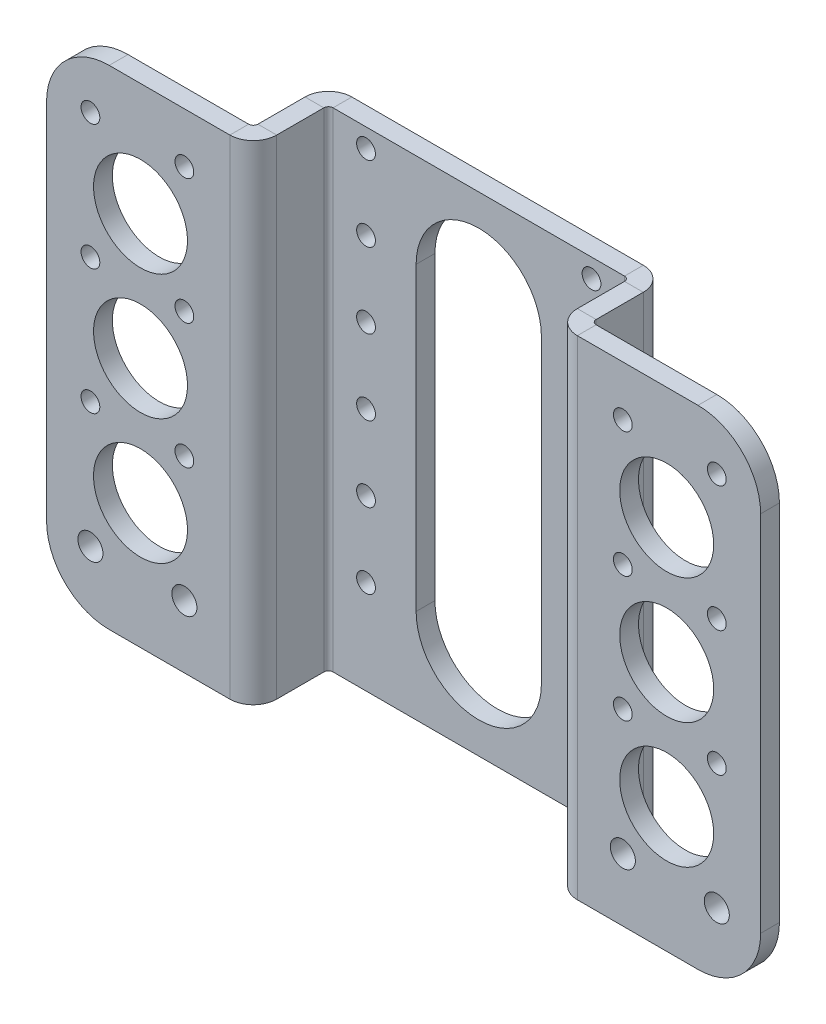
from build123d import *

# Parameters (mm, degrees)
SKETCH_1_W                    = 54
SKETCH_1_H                    = 93
SKETCH_1_R                    = 1.5
SKETCH_1_R_2                  = 1.44222051
EXTRUDE_1_DEPTH               = 15
SKETCH_2_W                    = 30
SKETCH_2_H                    = 93
EXTRUDE_2_DEPTH               = 15
SKETCH_6_W                    = 47.443029091
SKETCH_6_H                    = 20.19917442
SKETCH_6_W_2                  = 54.970930434
SKETCH_6_H_2                  = 26.340800681
SKETCH_6_W_3                  = 48
SKETCH_6_H_3                  = 18.172554383
CUT_EXTRUDE_1_DEPTH           = 111.104495821
SKETCH_7_W                    = 123.210575638
SKETCH_7_H                    = 28.057853858
CUT_EXTRUDE_2_DEPTH           = 106.085679329
SKETCH_9_R                    = 1.5
CUT_EXTRUDE_3_DEPTH           = 87.539008545
EXTRUDE_3_DEPTH               = 8
SKETCH_13_R                   = 2
SKETCH_13_R_2                 = 7.5
CUT_EXTRUDE_6_DEPTH           = 30
FILLET_1_R                    = 10
SHEET_START                   = 3
SHEET_METAL_1_OUTLINE_R       = 7.5
SHEET_METAL_1_OUTLINE_R_2     = 2
SHEET_METAL_1_OUTLINE_R_3     = 1.5
SHEET_METAL_1_DEPTH           = 12
SHEET_METAL_1_2_OUTLINE_R     = 7.5
SHEET_METAL_1_2_OUTLINE_R_2   = 2
SHEET_METAL_1_2_OUTLINE_R_3   = 1.5
SHEET_METAL_1_2_DEPTH         = 3
SHEET_METAL_1_3_OUTLINE_R     = 7.5
SHEET_METAL_1_3_OUTLINE_R_2   = 2
SHEET_METAL_1_3_OUTLINE_R_3   = 1.5
SHEET_METAL_1_3_DEPTH         = 3
SHEET_START_2                 = 12
SHEET_METAL_1_3_2_OUTLINE_R   = 7.5
SHEET_METAL_1_3_2_OUTLINE_R_2 = 2
SHEET_METAL_1_3_2_OUTLINE_R_3 = 1.5
SHEET_METAL_1_3_2_DEPTH       = 3
SHEET_METAL_1_3_3_OUTLINE_W   = 3
SHEET_METAL_1_3_3_OUTLINE_H   = 78
SHEET_METAL_1_3_3_DEPTH       = 9
SHEET_START_3                 = 11.2634
SHEET_METAL_1_3_4_OUTLINE_R   = 2
SHEET_METAL_1_3_4_OUTLINE_R_2 = 1.5
SHEET_METAL_1_3_4_DEPTH       = 0.7366
SHEET_START_4                 = -73
SHEET_METAL_1_3_5_DEPTH       = 80
SHEET_START_5                 = -72
SHEET_METAL_1_3_6_DEPTH       = 78


with BuildPart() as part:
    # Sketch 1 → 보스-돌출1 (new body)
    with BuildSketch(Plane.XY):
        with Locations((0, -40.5)):
            Rectangle(SKETCH_1_W, SKETCH_1_H)
        with Locations((18, -81)):
            Circle(SKETCH_1_R, mode=Mode.SUBTRACT)
        with Locations((-18, -81)):
            Circle(SKETCH_1_R_2, mode=Mode.SUBTRACT)
        with Locations((18, -69)):
            Circle(SKETCH_1_R, mode=Mode.SUBTRACT)
        with Locations((-18, -69)):
            Circle(SKETCH_1_R, mode=Mode.SUBTRACT)
        with Locations((18, -57)):
            Circle(SKETCH_1_R, mode=Mode.SUBTRACT)
        with Locations((-18, -57)):
            Circle(SKETCH_1_R, mode=Mode.SUBTRACT)
        with Locations((18, -45)):
            Circle(SKETCH_1_R, mode=Mode.SUBTRACT)
        with Locations((-18, -45)):
            Circle(SKETCH_1_R, mode=Mode.SUBTRACT)
        with Locations((18, -33)):
            Circle(SKETCH_1_R, mode=Mode.SUBTRACT)
        with Locations((-18, -33)):
            Circle(SKETCH_1_R, mode=Mode.SUBTRACT)
        with Locations((18, -21)):
            Circle(SKETCH_1_R, mode=Mode.SUBTRACT)
        with Locations((-18, -21)):
            Circle(SKETCH_1_R, mode=Mode.SUBTRACT)
        with Locations((18, -9)):
            Circle(SKETCH_1_R, mode=Mode.SUBTRACT)
        with Locations((-18, -9)):
            Circle(SKETCH_1_R, mode=Mode.SUBTRACT)
        with Locations((18, 3)):
            Circle(SKETCH_1_R, mode=Mode.SUBTRACT)
        with Locations((-18, 3)):
            Circle(SKETCH_1_R, mode=Mode.SUBTRACT)
    extrude(amount=EXTRUDE_1_DEPTH)

    # Sketch 2 → 보스-돌출2 (add)
    with BuildSketch(Plane.XY.offset(15)):
        with Locations((42, -40.5)):
            Rectangle(SKETCH_2_W, SKETCH_2_H)
        with Locations((-42, -40.5)):
            Rectangle(SKETCH_2_W, SKETCH_2_H)
    extrude(amount=-EXTRUDE_2_DEPTH)

    # 스케치6 → 컷-돌출1 (cut, through all)
    with BuildSketch(Plane.XZ.offset(87)):
        with Locations((-50.721514545, 1.90041279)):
            Rectangle(SKETCH_6_W, SKETCH_6_H)
        with Locations((54.485465217, -1.170400341)):
            Rectangle(SKETCH_6_W_2, SKETCH_6_H_2)
        with Locations((0, 12.086277192)):
            Rectangle(SKETCH_6_W_3, SKETCH_6_H_3)
    extrude(amount=-CUT_EXTRUDE_1_DEPTH, mode=Mode.SUBTRACT)

    # 스케치7 → 컷-돌출2 (cut, through all)
    with BuildSketch(Plane(origin=(0, 0, 0), x_dir=(-1, 0, 0), z_dir=(0, 0, -1))):
        with Locations((-0.121990669, -78.028926929)):
            Rectangle(SKETCH_7_W, SKETCH_7_H)
    extrude(amount=-CUT_EXTRUDE_2_DEPTH, mode=Mode.SUBTRACT)

    # 스케치9 → 컷-돌출3 (cut, through all)
    with BuildSketch(Plane(origin=(0, 0, 12), x_dir=(-1, 0, 0), z_dir=(0, 0, -1))):
        with Locations((-35, -2)):
            Circle(SKETCH_9_R)
        with Locations((-35, -22)):
            Circle(SKETCH_9_R)
        with Locations((-35, -42)):
            Circle(SKETCH_9_R)
        with Locations((-50, -2)):
            Circle(SKETCH_9_R)
        with Locations((-50, -22)):
            Circle(SKETCH_9_R)
        with Locations((-50, -42)):
            Circle(SKETCH_9_R)
        with Locations((50, -2)):
            Circle(SKETCH_9_R)
        with Locations((35, -2)):
            Circle(SKETCH_9_R)
        with Locations((35, -22)):
            Circle(SKETCH_9_R)
        with Locations((35, -42)):
            Circle(SKETCH_9_R)
        with Locations((50, -42)):
            Circle(SKETCH_9_R)
        with Locations((50, -22)):
            Circle(SKETCH_9_R)
    extrude(amount=-CUT_EXTRUDE_3_DEPTH, mode=Mode.SUBTRACT)

    # 스케치11 → 보스-돌출3 (add)
    with BuildSketch(Plane.XZ.offset(64)):
        Polygon((-57, 15), (-24, 15), (-24, 3), (24, 3), (24, 15), (57, 15), (57, 12), (27, 12), (27, 0), (-27, 0), (-27, 12), (-57, 12), align=None)
    extrude(amount=EXTRUDE_3_DEPTH)

    # 스케치13 → 컷-돌출6 (cut)
    with BuildSketch(Plane(origin=(0, 0, 0), x_dir=(-1, 0, 0), z_dir=(0, 0, -1))):
        with Locations(Location((-50, -62, 0), (0, 0, 180))):
            Circle(SKETCH_13_R)
        with Locations(Location((-35, -62, 0), (0, 0, 180))):
            Circle(SKETCH_13_R)
        with Locations(Location((35, -62, 0), (0, 0, 180))):
            Circle(SKETCH_13_R)
        with Locations(Location((50, -62, 0), (0, 0, 180))):
            Circle(SKETCH_13_R)
        with Locations(Location((42, -12, 0), (0, 0, 180))):
            Circle(SKETCH_13_R_2)
        with Locations(Location((42, -32, 0), (0, 0, 180))):
            Circle(SKETCH_13_R_2)
        with Locations(Location((-42, -12, 0), (0, 0, 180))):
            Circle(SKETCH_13_R_2)
        with Locations(Location((-42, -32, 0), (0, 0, 180))):
            Circle(SKETCH_13_R_2)
        with Locations(Location((-42, -52, 0), (0, 0, 180))):
            Circle(SKETCH_13_R_2)
        with Locations(Location((42, -52, 0), (0, 0, 180))):
            Circle(SKETCH_13_R_2)
        with BuildLine():
            Line((10, -9), (10, -57))
            ThreePointArc((10, -57), (0, -67), (-10, -57))
            Line((-10, -57), (-10, -9))
            ThreePointArc((-10, -9), (0, 1), (10, -9))
        make_face()
    extrude(amount=-CUT_EXTRUDE_6_DEPTH, mode=Mode.SUBTRACT)

    # 필렛1
    fillet_1_edges = [part.edges().sort_by_distance(p)[0] for p in [
        (-57, 6, 13.5),
        (57, 6, 13.5),
        (-57, -72, 13.5),
        (57, -72, 13.5),
    ]]
    fillet(fillet_1_edges, radius=FILLET_1_R)

    # Sheet Metal 1: read off the stored shape, not the designer's step
    # Sheet Metal 1 outline → Sheet Metal 1 (cut)
    # profile 1 of 2: a face of its own
    with BuildSketch(Plane.XY.offset(SHEET_START)):
        with BuildLine():
            Line((24, 6), (24, -72))
            Line((24, -72), (47, -72))
            ThreePointArc((47, -72), (54.071067812, -69.071067812), (57, -62))
            Line((57, -62), (57, -4))
            ThreePointArc((57, -4), (54.071067812, 3.071067812), (47, 6))
            Line((47, 6), (24, 6))
        make_face()
        with Locations((42, -12)):
            Circle(SHEET_METAL_1_OUTLINE_R, mode=Mode.SUBTRACT)
        with Locations((42, -32)):
            Circle(SHEET_METAL_1_OUTLINE_R, mode=Mode.SUBTRACT)
        with Locations((42, -52)):
            Circle(SHEET_METAL_1_OUTLINE_R, mode=Mode.SUBTRACT)
        with Locations((35, -62)):
            Circle(SHEET_METAL_1_OUTLINE_R_2, mode=Mode.SUBTRACT)
        with Locations((50, -62)):
            Circle(SHEET_METAL_1_OUTLINE_R_2, mode=Mode.SUBTRACT)
        with Locations((35, -42)):
            Circle(SHEET_METAL_1_OUTLINE_R_3, mode=Mode.SUBTRACT)
        with Locations((50, -42)):
            Circle(SHEET_METAL_1_OUTLINE_R_3, mode=Mode.SUBTRACT)
        with Locations((35, -22)):
            Circle(SHEET_METAL_1_OUTLINE_R_3, mode=Mode.SUBTRACT)
        with Locations((50, -22)):
            Circle(SHEET_METAL_1_OUTLINE_R_3, mode=Mode.SUBTRACT)
        with Locations((35, -2)):
            Circle(SHEET_METAL_1_OUTLINE_R_3, mode=Mode.SUBTRACT)
        with Locations((50, -2)):
            Circle(SHEET_METAL_1_OUTLINE_R_3, mode=Mode.SUBTRACT)
    # profile 2 of 2: a face of its own
    with BuildSketch(Plane.XY.offset(SHEET_START)):
        with BuildLine():
            Line((-24, -72), (-24, 6))
            Line((-24, 6), (-47, 6))
            ThreePointArc((-47, 6), (-54.071067812, 3.071067812), (-57, -4))
            Line((-57, -4), (-57, -62))
            ThreePointArc((-57, -62), (-54.071067812, -69.071067812), (-47, -72))
            Line((-47, -72), (-24, -72))
        make_face()
        with Locations((-35, -2)):
            Circle(SHEET_METAL_1_OUTLINE_R_3, mode=Mode.SUBTRACT)
        with Locations((-42, -52)):
            Circle(SHEET_METAL_1_OUTLINE_R, mode=Mode.SUBTRACT)
        with Locations((-42, -32)):
            Circle(SHEET_METAL_1_OUTLINE_R, mode=Mode.SUBTRACT)
        with Locations((-42, -12)):
            Circle(SHEET_METAL_1_OUTLINE_R, mode=Mode.SUBTRACT)
        with Locations((-50, -62)):
            Circle(SHEET_METAL_1_OUTLINE_R_2, mode=Mode.SUBTRACT)
        with Locations((-35, -62)):
            Circle(SHEET_METAL_1_OUTLINE_R_2, mode=Mode.SUBTRACT)
        with Locations((-50, -42)):
            Circle(SHEET_METAL_1_OUTLINE_R_3, mode=Mode.SUBTRACT)
        with Locations((-35, -42)):
            Circle(SHEET_METAL_1_OUTLINE_R_3, mode=Mode.SUBTRACT)
        with Locations((-50, -22)):
            Circle(SHEET_METAL_1_OUTLINE_R_3, mode=Mode.SUBTRACT)
        with Locations((-35, -22)):
            Circle(SHEET_METAL_1_OUTLINE_R_3, mode=Mode.SUBTRACT)
        with Locations((-50, -2)):
            Circle(SHEET_METAL_1_OUTLINE_R_3, mode=Mode.SUBTRACT)
    extrude(amount=SHEET_METAL_1_DEPTH, mode=Mode.SUBTRACT)

    # Sheet Metal 1 2 outline → Sheet Metal 1 2 (add)
    # profile 1 of 2: a face of its own
    with BuildSketch(Plane.XY):
        with BuildLine():
            Line((27, 6), (27, -72))
            Line((27, -72), (57.080086129, -72))
            ThreePointArc((57.080086129, -72), (64.151153941, -69.071067812), (67.080086129, -62))
            Line((67.080086129, -62), (67.080086129, -4))
            ThreePointArc((67.080086129, -4), (64.151153941, 3.071067812), (57.080086129, 6))
            Line((57.080086129, 6), (27, 6))
        make_face()
        with Locations((52.080086129, -12)):
            Circle(SHEET_METAL_1_2_OUTLINE_R, mode=Mode.SUBTRACT)
        with Locations((52.080086129, -32)):
            Circle(SHEET_METAL_1_2_OUTLINE_R, mode=Mode.SUBTRACT)
        with Locations((52.080086129, -52)):
            Circle(SHEET_METAL_1_2_OUTLINE_R, mode=Mode.SUBTRACT)
        with Locations((45.080086129, -62)):
            Circle(SHEET_METAL_1_2_OUTLINE_R_2, mode=Mode.SUBTRACT)
        with Locations((45.080086129, -42)):
            Circle(SHEET_METAL_1_2_OUTLINE_R_3, mode=Mode.SUBTRACT)
        with Locations((45.080086129, -22)):
            Circle(SHEET_METAL_1_2_OUTLINE_R_3, mode=Mode.SUBTRACT)
        with Locations((45.080086129, -2)):
            Circle(SHEET_METAL_1_2_OUTLINE_R_3, mode=Mode.SUBTRACT)
        with Locations((60.080086129, -22)):
            Circle(SHEET_METAL_1_2_OUTLINE_R_3, mode=Mode.SUBTRACT)
        with Locations((60.080086129, -2)):
            Circle(SHEET_METAL_1_2_OUTLINE_R_3, mode=Mode.SUBTRACT)
        with Locations((60.080086129, -62)):
            Circle(SHEET_METAL_1_2_OUTLINE_R_2, mode=Mode.SUBTRACT)
        with Locations((60.080086129, -42)):
            Circle(SHEET_METAL_1_2_OUTLINE_R_3, mode=Mode.SUBTRACT)
    # profile 2 of 2: a face of its own
    with BuildSketch(Plane.XY):
        with BuildLine():
            Line((-27, -72), (-27, 6))
            Line((-27, 6), (-57.080086129, 6))
            ThreePointArc((-57.080086129, 6), (-64.151153941, 3.071067812), (-67.080086129, -4))
            Line((-67.080086129, -4), (-67.080086129, -62))
            ThreePointArc((-67.080086129, -62), (-64.151153941, -69.071067812), (-57.080086129, -72))
            Line((-57.080086129, -72), (-27, -72))
        make_face()
        with Locations((-52.080086129, -52)):
            Circle(SHEET_METAL_1_2_OUTLINE_R, mode=Mode.SUBTRACT)
        with Locations((-52.080086129, -32)):
            Circle(SHEET_METAL_1_2_OUTLINE_R, mode=Mode.SUBTRACT)
        with Locations((-52.080086129, -12)):
            Circle(SHEET_METAL_1_2_OUTLINE_R, mode=Mode.SUBTRACT)
        with Locations((-45.080086129, -62)):
            Circle(SHEET_METAL_1_2_OUTLINE_R_2, mode=Mode.SUBTRACT)
        with Locations((-45.080086129, -42)):
            Circle(SHEET_METAL_1_2_OUTLINE_R_3, mode=Mode.SUBTRACT)
        with Locations((-45.080086129, -22)):
            Circle(SHEET_METAL_1_2_OUTLINE_R_3, mode=Mode.SUBTRACT)
        with Locations((-45.080086129, -2)):
            Circle(SHEET_METAL_1_2_OUTLINE_R_3, mode=Mode.SUBTRACT)
        with Locations((-60.080086129, -62)):
            Circle(SHEET_METAL_1_2_OUTLINE_R_2, mode=Mode.SUBTRACT)
        with Locations((-60.080086129, -42)):
            Circle(SHEET_METAL_1_2_OUTLINE_R_3, mode=Mode.SUBTRACT)
        with Locations((-60.080086129, -22)):
            Circle(SHEET_METAL_1_2_OUTLINE_R_3, mode=Mode.SUBTRACT)
        with Locations((-60.080086129, -2)):
            Circle(SHEET_METAL_1_2_OUTLINE_R_3, mode=Mode.SUBTRACT)
    extrude(amount=SHEET_METAL_1_2_DEPTH)

    # Sheet Metal 1 3: read off the stored shape, not the designer's step
    # Sheet Metal 1 3 outline → Sheet Metal 1 3 (cut)
    # profile 1 of 2: a face of its own
    with BuildSketch(Plane.XY):
        with BuildLine():
            ThreePointArc((-57.080086129, 6), (-64.151153941, 3.071067812), (-67.080086129, -4))
            Line((-67.080086129, -4), (-67.080086129, -62))
            ThreePointArc((-67.080086129, -62), (-64.151153941, -69.071067812), (-57.080086129, -72))
            Line((-57.080086129, -72), (-27, -72))
            Line((-27, -72), (-27, 6))
            Line((-27, 6), (-57.080086129, 6))
        make_face()
        with Locations((-52.080086129, -52)):
            Circle(SHEET_METAL_1_3_OUTLINE_R, mode=Mode.SUBTRACT)
        with Locations((-52.080086129, -32)):
            Circle(SHEET_METAL_1_3_OUTLINE_R, mode=Mode.SUBTRACT)
        with Locations((-52.080086129, -12)):
            Circle(SHEET_METAL_1_3_OUTLINE_R, mode=Mode.SUBTRACT)
        with Locations((-45.080086129, -62)):
            Circle(SHEET_METAL_1_3_OUTLINE_R_2, mode=Mode.SUBTRACT)
        with Locations((-45.080086129, -42)):
            Circle(SHEET_METAL_1_3_OUTLINE_R_3, mode=Mode.SUBTRACT)
        with Locations((-45.080086129, -22)):
            Circle(SHEET_METAL_1_3_OUTLINE_R_3, mode=Mode.SUBTRACT)
        with Locations((-45.080086129, -2)):
            Circle(SHEET_METAL_1_3_OUTLINE_R_3, mode=Mode.SUBTRACT)
        with Locations((-60.080086129, -2)):
            Circle(SHEET_METAL_1_3_OUTLINE_R_3, mode=Mode.SUBTRACT)
        with Locations((-60.080086129, -62)):
            Circle(SHEET_METAL_1_3_OUTLINE_R_2, mode=Mode.SUBTRACT)
        with Locations((-60.080086129, -42)):
            Circle(SHEET_METAL_1_3_OUTLINE_R_3, mode=Mode.SUBTRACT)
        with Locations((-60.080086129, -22)):
            Circle(SHEET_METAL_1_3_OUTLINE_R_3, mode=Mode.SUBTRACT)
    # profile 2 of 2: a face of its own
    with BuildSketch(Plane.XY):
        with BuildLine():
            Line((27, -72), (57.080086129, -72))
            ThreePointArc((57.080086129, -72), (64.151153941, -69.071067812), (67.080086129, -62))
            Line((67.080086129, -62), (67.080086129, -4))
            ThreePointArc((67.080086129, -4), (64.151153941, 3.071067812), (57.080086129, 6))
            Line((57.080086129, 6), (27, 6))
            Line((27, 6), (27, -72))
        make_face()
        with Locations((52.080086129, -12)):
            Circle(SHEET_METAL_1_3_OUTLINE_R, mode=Mode.SUBTRACT)
        with Locations((52.080086129, -32)):
            Circle(SHEET_METAL_1_3_OUTLINE_R, mode=Mode.SUBTRACT)
        with Locations((52.080086129, -52)):
            Circle(SHEET_METAL_1_3_OUTLINE_R, mode=Mode.SUBTRACT)
        with Locations((45.080086129, -62)):
            Circle(SHEET_METAL_1_3_OUTLINE_R_2, mode=Mode.SUBTRACT)
        with Locations((45.080086129, -42)):
            Circle(SHEET_METAL_1_3_OUTLINE_R_3, mode=Mode.SUBTRACT)
        with Locations((45.080086129, -22)):
            Circle(SHEET_METAL_1_3_OUTLINE_R_3, mode=Mode.SUBTRACT)
        with Locations((45.080086129, -2)):
            Circle(SHEET_METAL_1_3_OUTLINE_R_3, mode=Mode.SUBTRACT)
        with Locations((60.080086129, -62)):
            Circle(SHEET_METAL_1_3_OUTLINE_R_2, mode=Mode.SUBTRACT)
        with Locations((60.080086129, -42)):
            Circle(SHEET_METAL_1_3_OUTLINE_R_3, mode=Mode.SUBTRACT)
        with Locations((60.080086129, -22)):
            Circle(SHEET_METAL_1_3_OUTLINE_R_3, mode=Mode.SUBTRACT)
        with Locations((60.080086129, -2)):
            Circle(SHEET_METAL_1_3_OUTLINE_R_3, mode=Mode.SUBTRACT)
    extrude(amount=SHEET_METAL_1_3_DEPTH, mode=Mode.SUBTRACT)



with BuildPart() as body_2:
    # Sheet Metal 1 3 2 outline → Sheet Metal 1 3 2 (new body)
    # profile 1 of 2: a face of its own
    with BuildSketch(Plane.XY.offset(SHEET_START_2)):
        with BuildLine():
            ThreePointArc((-57, -62), (-54.071067812, -69.071067812), (-47, -72))
            Line((-47, -72), (-24, -72))
            Line((-24, -72), (-24, 6))
            Line((-24, 6), (-47, 6))
            ThreePointArc((-47, 6), (-54.071067812, 3.071067812), (-57, -4))
            Line((-57, -4), (-57, -62))
        make_face()
        with Locations((-42, -52)):
            Circle(SHEET_METAL_1_3_2_OUTLINE_R, mode=Mode.SUBTRACT)
        with Locations((-42, -32)):
            Circle(SHEET_METAL_1_3_2_OUTLINE_R, mode=Mode.SUBTRACT)
        with Locations((-42, -12)):
            Circle(SHEET_METAL_1_3_2_OUTLINE_R, mode=Mode.SUBTRACT)
        with Locations((-50, -62)):
            Circle(SHEET_METAL_1_3_2_OUTLINE_R_2, mode=Mode.SUBTRACT)
        with Locations((-35, -62)):
            Circle(SHEET_METAL_1_3_2_OUTLINE_R_2, mode=Mode.SUBTRACT)
        with Locations((-50, -42)):
            Circle(SHEET_METAL_1_3_2_OUTLINE_R_3, mode=Mode.SUBTRACT)
        with Locations((-35, -42)):
            Circle(SHEET_METAL_1_3_2_OUTLINE_R_3, mode=Mode.SUBTRACT)
        with Locations((-50, -22)):
            Circle(SHEET_METAL_1_3_2_OUTLINE_R_3, mode=Mode.SUBTRACT)
        with Locations((-35, -22)):
            Circle(SHEET_METAL_1_3_2_OUTLINE_R_3, mode=Mode.SUBTRACT)
        with Locations((-50, -2)):
            Circle(SHEET_METAL_1_3_2_OUTLINE_R_3, mode=Mode.SUBTRACT)
        with Locations((-35, -2)):
            Circle(SHEET_METAL_1_3_2_OUTLINE_R_3, mode=Mode.SUBTRACT)
    # profile 2 of 2: a face of its own
    with BuildSketch(Plane.XY.offset(SHEET_START_2)):
        with BuildLine():
            ThreePointArc((47, -72), (54.071067812, -69.071067812), (57, -62))
            Line((57, -62), (57, -4))
            ThreePointArc((57, -4), (54.071067812, 3.071067812), (47, 6))
            Line((47, 6), (24, 6))
            Line((24, 6), (24, -72))
            Line((24, -72), (47, -72))
        make_face()
        with Locations((42, -12)):
            Circle(SHEET_METAL_1_3_2_OUTLINE_R, mode=Mode.SUBTRACT)
        with Locations((42, -32)):
            Circle(SHEET_METAL_1_3_2_OUTLINE_R, mode=Mode.SUBTRACT)
        with Locations((42, -52)):
            Circle(SHEET_METAL_1_3_2_OUTLINE_R, mode=Mode.SUBTRACT)
        with Locations((35, -62)):
            Circle(SHEET_METAL_1_3_2_OUTLINE_R_2, mode=Mode.SUBTRACT)
        with Locations((50, -62)):
            Circle(SHEET_METAL_1_3_2_OUTLINE_R_2, mode=Mode.SUBTRACT)
        with Locations((35, -42)):
            Circle(SHEET_METAL_1_3_2_OUTLINE_R_3, mode=Mode.SUBTRACT)
        with Locations((50, -42)):
            Circle(SHEET_METAL_1_3_2_OUTLINE_R_3, mode=Mode.SUBTRACT)
        with Locations((35, -22)):
            Circle(SHEET_METAL_1_3_2_OUTLINE_R_3, mode=Mode.SUBTRACT)
        with Locations((50, -22)):
            Circle(SHEET_METAL_1_3_2_OUTLINE_R_3, mode=Mode.SUBTRACT)
        with Locations((35, -2)):
            Circle(SHEET_METAL_1_3_2_OUTLINE_R_3, mode=Mode.SUBTRACT)
        with Locations((50, -2)):
            Circle(SHEET_METAL_1_3_2_OUTLINE_R_3, mode=Mode.SUBTRACT)
    extrude(amount=SHEET_METAL_1_3_2_DEPTH)


with BuildPart() as part_1:
    add(part.part)

    add(body_2.part)  # Sheet Metal 1 3 3 merges body 2
    # Sheet Metal 1 3 3 outline → Sheet Metal 1 3 3 (add)
    with BuildSketch(Plane.XY.offset(SHEET_START)):
        with Locations((-25.5, -33)):
            Rectangle(SHEET_METAL_1_3_3_OUTLINE_W, SHEET_METAL_1_3_3_OUTLINE_H)
        with Locations((25.5, -33)):
            Rectangle(SHEET_METAL_1_3_3_OUTLINE_W, SHEET_METAL_1_3_3_OUTLINE_H)
    extrude(amount=SHEET_METAL_1_3_3_DEPTH)

    # Sheet Metal 1 3 4 outline → Sheet Metal 1 3 4 (add)
    # profile 1 of 2: a face of its own
    with BuildSketch(Plane.XY.offset(SHEET_START_3)):
        with BuildLine():
            ThreePointArc((-47.040043064, -46.445905483), (-34.5, -52), (-47.040043064, -57.554094517))
            ThreePointArc((-47.040043064, -57.554094517), (-51.999753786, -59.499569769), (-57, -57.660781527))
            Line((-57, -57.660781527), (-57, -62))
            ThreePointArc((-57, -62), (-54.071067812, -69.071067812), (-47, -72))
            Line((-47, -72), (-27, -72))
            Line((-27, -72), (-27, 6))
            Line((-27, 6), (-47, 6))
            ThreePointArc((-47, 6), (-54.071067812, 3.071067812), (-57, -4))
            Line((-57, -4), (-57, -6.339218473))
            ThreePointArc((-57, -6.339218473), (-51.999753786, -4.500430231), (-47.040043064, -6.445905483))
            ThreePointArc((-47.040043064, -6.445905483), (-34.5, -12), (-47.040043064, -17.554094517))
            ThreePointArc((-47.040043064, -17.554094517), (-51.999753786, -19.499569769), (-57, -17.660781527))
            Line((-57, -17.660781527), (-57, -26.339218473))
            ThreePointArc((-57, -26.339218473), (-51.999753786, -24.500430231), (-47.040043065, -26.445905483))
            ThreePointArc((-47.040043065, -26.445905483), (-34.5, -32), (-47.040043064, -37.554094517))
            ThreePointArc((-47.040043064, -37.554094517), (-51.999753786, -39.499569769), (-57, -37.660781527))
            Line((-57, -37.660781527), (-57, -46.339218473))
            ThreePointArc((-57, -46.339218473), (-51.999753786, -44.500430231), (-47.040043064, -46.445905483))
        make_face()
        with Locations((-50, -62)):
            Circle(SHEET_METAL_1_3_4_OUTLINE_R, mode=Mode.SUBTRACT)
        with Locations((-45.080086129, -62)):
            Circle(SHEET_METAL_1_3_4_OUTLINE_R, mode=Mode.SUBTRACT)
        with Locations((-35, -62)):
            Circle(SHEET_METAL_1_3_4_OUTLINE_R, mode=Mode.SUBTRACT)
        with Locations((-50, -42)):
            Circle(SHEET_METAL_1_3_4_OUTLINE_R_2, mode=Mode.SUBTRACT)
        with Locations((-45.080086129, -42)):
            Circle(SHEET_METAL_1_3_4_OUTLINE_R_2, mode=Mode.SUBTRACT)
        with Locations((-35, -42)):
            Circle(SHEET_METAL_1_3_4_OUTLINE_R_2, mode=Mode.SUBTRACT)
        with Locations((-50, -22)):
            Circle(SHEET_METAL_1_3_4_OUTLINE_R_2, mode=Mode.SUBTRACT)
        with Locations((-45.080086129, -22)):
            Circle(SHEET_METAL_1_3_4_OUTLINE_R_2, mode=Mode.SUBTRACT)
        with Locations((-35, -22)):
            Circle(SHEET_METAL_1_3_4_OUTLINE_R_2, mode=Mode.SUBTRACT)
        with Locations((-50, -2)):
            Circle(SHEET_METAL_1_3_4_OUTLINE_R_2, mode=Mode.SUBTRACT)
        with Locations((-45.080086129, -2)):
            Circle(SHEET_METAL_1_3_4_OUTLINE_R_2, mode=Mode.SUBTRACT)
        with Locations((-35, -2)):
            Circle(SHEET_METAL_1_3_4_OUTLINE_R_2, mode=Mode.SUBTRACT)
    # profile 2 of 2: a face of its own
    with BuildSketch(Plane.XY.offset(SHEET_START_3)):
        with BuildLine():
            Line((27, -72), (47, -72))
            ThreePointArc((47, -72), (54.071067812, -69.071067812), (57, -62))
            Line((57, -62), (57, -57.660781527))
            ThreePointArc((57, -57.660781527), (51.999753786, -59.499569769), (47.040043064, -57.554094517))
            ThreePointArc((47.040043064, -57.554094517), (34.5, -52), (47.040043064, -46.445905483))
            ThreePointArc((47.040043064, -46.445905483), (51.999753786, -44.500430231), (57, -46.339218473))
            Line((57, -46.339218473), (57, -37.660781527))
            ThreePointArc((57, -37.660781527), (51.999753786, -39.499569769), (47.040043064, -37.554094517))
            ThreePointArc((47.040043064, -37.554094517), (34.5, -32), (47.040043064, -26.445905483))
            ThreePointArc((47.040043064, -26.445905483), (51.999753786, -24.500430231), (57, -26.339218473))
            Line((57, -26.339218473), (57, -17.660781527))
            ThreePointArc((57, -17.660781527), (51.999753786, -19.499569769), (47.040043064, -17.554094517))
            ThreePointArc((47.040043064, -17.554094517), (34.5, -12), (47.040043064, -6.445905483))
            ThreePointArc((47.040043064, -6.445905483), (51.999753786, -4.500430231), (57, -6.339218473))
            Line((57, -6.339218473), (57, -4))
            ThreePointArc((57, -4), (54.071067812, 3.071067812), (47, 6))
            Line((47, 6), (27, 6))
            Line((27, 6), (27, -72))
        make_face()
        with Locations((35, -62)):
            Circle(SHEET_METAL_1_3_4_OUTLINE_R, mode=Mode.SUBTRACT)
        with Locations((45.080086129, -62)):
            Circle(SHEET_METAL_1_3_4_OUTLINE_R, mode=Mode.SUBTRACT)
        with Locations((50, -62)):
            Circle(SHEET_METAL_1_3_4_OUTLINE_R, mode=Mode.SUBTRACT)
        with Locations((35, -42)):
            Circle(SHEET_METAL_1_3_4_OUTLINE_R_2, mode=Mode.SUBTRACT)
        with Locations((45.080086129, -42)):
            Circle(SHEET_METAL_1_3_4_OUTLINE_R_2, mode=Mode.SUBTRACT)
        with Locations((50, -42)):
            Circle(SHEET_METAL_1_3_4_OUTLINE_R_2, mode=Mode.SUBTRACT)
        with Locations((35, -22)):
            Circle(SHEET_METAL_1_3_4_OUTLINE_R_2, mode=Mode.SUBTRACT)
        with Locations((45.080086129, -22)):
            Circle(SHEET_METAL_1_3_4_OUTLINE_R_2, mode=Mode.SUBTRACT)
        with Locations((50, -22)):
            Circle(SHEET_METAL_1_3_4_OUTLINE_R_2, mode=Mode.SUBTRACT)
        with Locations((35, -2)):
            Circle(SHEET_METAL_1_3_4_OUTLINE_R_2, mode=Mode.SUBTRACT)
        with Locations((45.080086129, -2)):
            Circle(SHEET_METAL_1_3_4_OUTLINE_R_2, mode=Mode.SUBTRACT)
        with Locations((50, -2)):
            Circle(SHEET_METAL_1_3_4_OUTLINE_R_2, mode=Mode.SUBTRACT)
    extrude(amount=SHEET_METAL_1_3_4_DEPTH)

    # Sheet Metal 1 3 5 outline → Sheet Metal 1 3 5 (cut)
    with BuildSketch(Plane(origin=(0, 0, 0), x_dir=(1, 0, 0), z_dir=(0, 1, 0)).offset(SHEET_START_4)):
        with BuildLine():
            Line((-57, -11.2634), (-57, -12))
            Line((-57, -12), (-27.7366, -12))
            ThreePointArc((-27.7366, -12), (-27.215745145, -11.784254855), (-27, -11.2634))
            Line((-27, -11.2634), (-57, -11.2634))
        make_face()
        with BuildLine():
            ThreePointArc((-24, -11.2634), (-25.094424801, -13.905575199), (-27.7366, -15))
            Line((-27.7366, -15), (-24, -15))
            Line((-24, -15), (-24, -11.2634))
        make_face()
        with BuildLine():
            Line((-27, 0), (-27, -3.7366))
            ThreePointArc((-27, -3.7366), (-25.905575199, -1.094424801), (-23.2634, 0))
            Line((-23.2634, 0), (-27, 0))
        make_face()
        with BuildLine():
            Line((27, 0), (23.2634, 0))
            ThreePointArc((23.2634, 0), (25.905575199, -1.094424801), (27, -3.7366))
            Line((27, -3.7366), (27, 0))
        make_face()
        with BuildLine():
            Line((57, -11.2634), (27, -11.2634))
            ThreePointArc((27, -11.2634), (27.215745145, -11.784254855), (27.7366, -12))
            Line((27.7366, -12), (57, -12))
            Line((57, -12), (57, -11.2634))
        make_face()
        with BuildLine():
            ThreePointArc((27.7366, -15), (25.094424801, -13.905575199), (24, -11.2634))
            Line((24, -11.2634), (24, -15))
            Line((24, -15), (27.7366, -15))
        make_face()
    extrude(amount=SHEET_METAL_1_3_5_DEPTH, mode=Mode.SUBTRACT)

    # Sheet Metal 1 3 6 outline → Sheet Metal 1 3 6 (add)
    with BuildSketch(Plane(origin=(0, 0, 0), x_dir=(1, 0, 0), z_dir=(0, 1, 0)).offset(SHEET_START_5)):
        with BuildLine():
            Line((-24, -3), (-24, -3.7366))
            ThreePointArc((-24, -3.7366), (-23.784254855, -3.215745145), (-23.2634, -3))
            Line((-23.2634, -3), (-24, -3))
        make_face()
        with BuildLine():
            Line((24, -3), (23.2634, -3))
            ThreePointArc((23.2634, -3), (23.784254855, -3.215745145), (24, -3.7366))
            Line((24, -3.7366), (24, -3))
        make_face()
    extrude(amount=SHEET_METAL_1_3_6_DEPTH)


solid = part_1.part
